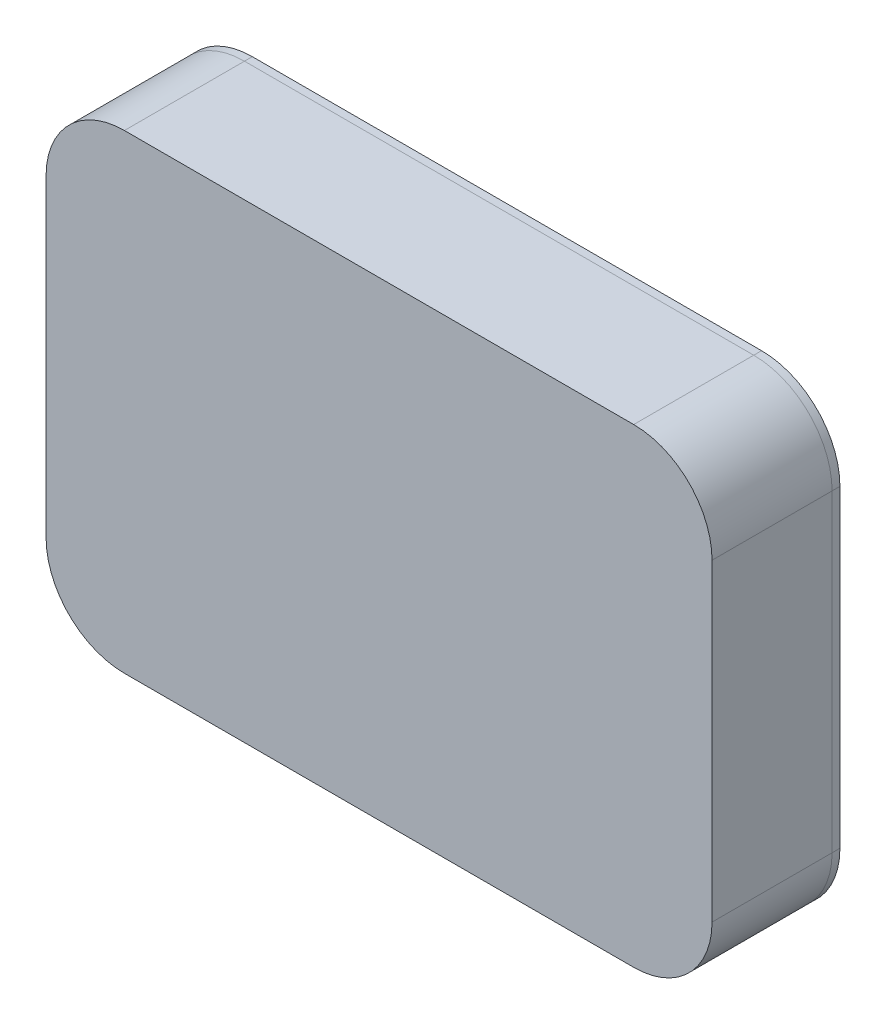
from build123d import *

# Parameters (mm, degrees)
BOSS_EXTRU_1_DEPTH = 1.2
CONG_1_R           = 2


with BuildPart() as part:
    # Balayage1: sweep along a path in Esquisse1
    with BuildLine(Plane.XY) as balayage1_path:
        Line((-32.5, 30), (32.5, 30))
        ThreePointArc((32.5, 30), (39.571067812, 27.071067812), (42.5, 20))
        Line((42.5, 20), (42.5, -20))
        ThreePointArc((42.5, -20), (39.571067812, -27.071067812), (32.5, -30))
        Line((32.5, -30), (-32.5, -30))
        ThreePointArc((-32.5, -30), (-39.571067812, -27.071067812), (-42.5, -20))
        Line((-42.5, -20), (-42.5, 20))
        ThreePointArc((-42.5, 20), (-39.571067812, 27.071067812), (-32.5, 30))
    # profil → Balayage1 (sweep)
    with BuildSketch(Plane(origin=(0, 0, 0), x_dir=(0, 0, -1), z_dir=(1, 0, 0))):
        with BuildLine():
            Line((0, -28.4), (5.297182453, -28.4))
            Line((5.297182453, -28.4), (14.1228, -23.8))
            Line((14.1228, -23.8), (15.1228, -23.8))
            Line((15.1228, -23.8), (15.1228, -25.4))
            Line((15.1228, -25.4), (14.1228, -25.4))
            ThreePointArc((14.1228, -25.4), (12.6228, -26.9), (14.1228, -28.4))
            Line((14.1228, -28.4), (15.1228, -28.4))
            Line((15.1228, -28.4), (15.1228, -30))
            Line((15.1228, -30), (14.1228, -30))
            Line((14.1228, -30), (0, -30))
            Line((0, -30), (0, -28.4))
        make_face()
    sweep(path=balayage1_path.line)

    # Esquisse1<3> → Boss.-Extru.1 (add)
    with BuildSketch(Plane.XY):
        with BuildLine():
            Line((-32.5, 30), (32.5, 30))
            ThreePointArc((32.5, 30), (39.571067812, 27.071067812), (42.5, 20))
            Line((42.5, 20), (42.5, -20))
            ThreePointArc((42.5, -20), (39.571067812, -27.071067812), (32.5, -30))
            Line((32.5, -30), (-32.5, -30))
            ThreePointArc((-32.5, -30), (-39.571067812, -27.071067812), (-42.5, -20))
            Line((-42.5, -20), (-42.5, 20))
            ThreePointArc((-42.5, 20), (-39.571067812, 27.071067812), (-32.5, 30))
        make_face()
    extrude(amount=BOSS_EXTRU_1_DEPTH)

    # Congé1
    cong_1_edges = [part.edges().sort_by_distance(p)[0] for p in [
        (-38.439696962, 25.939696962, 0),
        (-40.9, 0, 0),
        (-38.439696962, -25.939696962, 0),
        (0, -28.4, 0),
        (0, -28.4, 0),
        (38.439696962, -25.939696962, 0),
        (40.9, 0, 0),
        (38.439696962, 25.939696962, 0),
        (0, 28.4, 0),
    ]]
    fillet(cong_1_edges, radius=CONG_1_R)


solid = part.part
